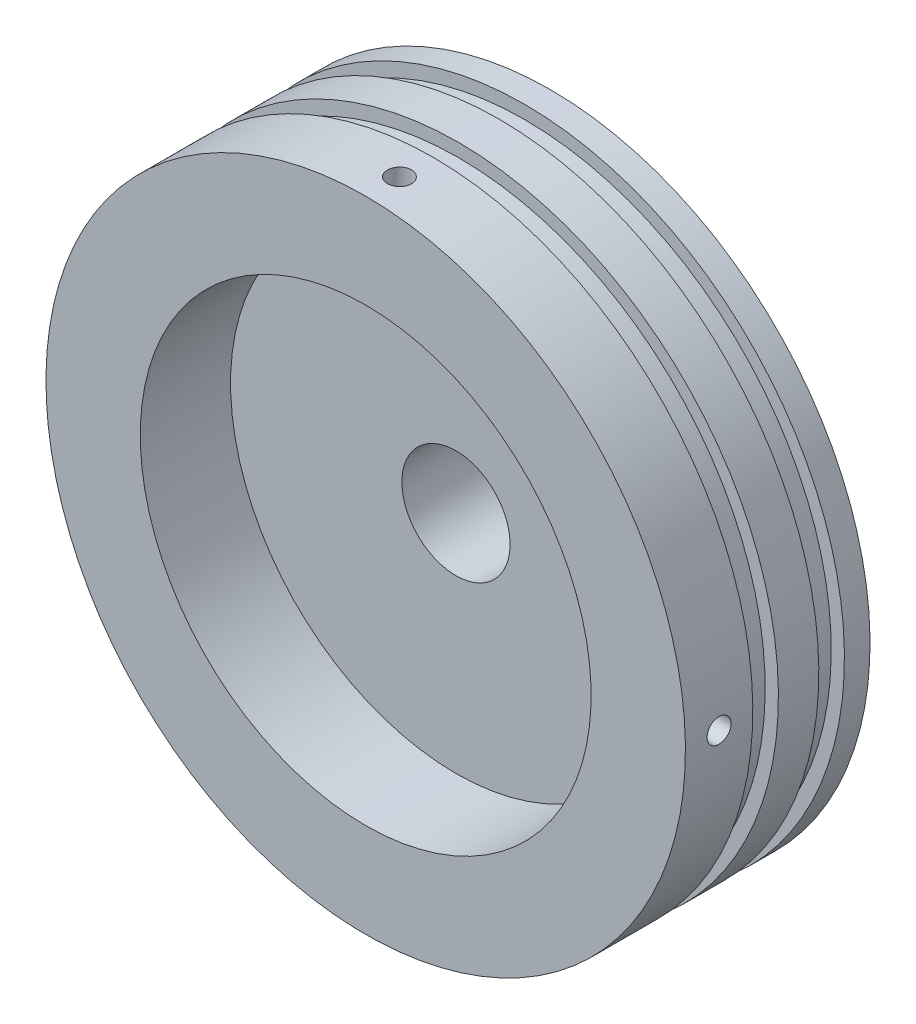
from build123d import *

# Parameters (mm, degrees)
F_4_40_TAPPED_HOLE1_D               = 2.2606
F_4_40_TAPPED_HOLE1_DEPTH           = 7.62
F_4_40_TAPPED_HOLE1_TIP             = 0.679152758
F_4_40_TAPPED_HOLE1_ON_FACE_2_D     = 2.2606
F_4_40_TAPPED_HOLE1_ON_FACE_2_DEPTH = 7.62
F_4_40_TAPPED_HOLE1_ON_FACE_2_TIP   = 0.679152758
F_4_40_TAPPED_HOLE1_ON_FACE_3_D     = 2.2606
F_4_40_TAPPED_HOLE1_ON_FACE_3_DEPTH = 7.62
F_4_40_TAPPED_HOLE1_ON_FACE_3_TIP   = 0.679152758
F_4_40_TAPPED_HOLE1_ON_FACE_4_D     = 2.2606
F_4_40_TAPPED_HOLE1_ON_FACE_4_DEPTH = 7.62
F_4_40_TAPPED_HOLE1_ON_FACE_4_TIP   = 0.679152758
F_10_2_10_2_DIAMETER_HOLE1_D        = 10.2


with BuildPart() as part:
    # Sketch2 → Revolve1 (revolve)
    with BuildSketch(Plane(origin=(0, 0, 0), x_dir=(0, 0, -1), z_dir=(1, 0, 0))):
        Polygon((-17.399, 30.1371), (-11.049, 30.1371), (-11.049, 28.8925), (-8.636, 28.8925), (-8.636, 30.1371), (-4.826, 30.1371), (-4.826, 28.8925), (-2.413, 28.8925), (-2.413, 30.1371), (0, 30.1371), (0, 0), (-8.89, 0), (-8.89, 21.2471), (-17.399, 21.2471), align=None)
    revolve(axis=Axis((0, 0, 0), (0, 0, 1)))

    # #4-40 Tapped Hole1
    with Locations(Plane(origin=(0, -30.1371, 14.224), x_dir=(-1, 0, 0), z_dir=(0, -1, 0))):
        with Locations((0, 0)):
            Hole(F_4_40_TAPPED_HOLE1_D / 2, depth=F_4_40_TAPPED_HOLE1_DEPTH)
            with Locations((0, 0, -(F_4_40_TAPPED_HOLE1_DEPTH + F_4_40_TAPPED_HOLE1_TIP / 2))):  # 118° drill point
                Cone(0, F_4_40_TAPPED_HOLE1_D / 2, F_4_40_TAPPED_HOLE1_TIP, mode=Mode.SUBTRACT)

    # #4-40 Tapped Hole1 on face 2
    with Locations(Plane(origin=(30.1371, 0, 14.224), x_dir=(0, 0, 1), z_dir=(1, 0, 0))):
        with Locations((0, 0)):
            Hole(F_4_40_TAPPED_HOLE1_ON_FACE_2_D / 2, depth=F_4_40_TAPPED_HOLE1_ON_FACE_2_DEPTH)
            with Locations((0, 0, -(F_4_40_TAPPED_HOLE1_ON_FACE_2_DEPTH + F_4_40_TAPPED_HOLE1_ON_FACE_2_TIP / 2))):  # 118° drill point
                Cone(0, F_4_40_TAPPED_HOLE1_ON_FACE_2_D / 2, F_4_40_TAPPED_HOLE1_ON_FACE_2_TIP, mode=Mode.SUBTRACT)

    # #4-40 Tapped Hole1 on face 3
    with Locations(Plane(origin=(-30.1371, 0, 14.224), x_dir=(0, 0, -1), z_dir=(-1, 0, 0))):
        with Locations((0, 0)):
            Hole(F_4_40_TAPPED_HOLE1_ON_FACE_3_D / 2, depth=F_4_40_TAPPED_HOLE1_ON_FACE_3_DEPTH)
            with Locations((0, 0, -(F_4_40_TAPPED_HOLE1_ON_FACE_3_DEPTH + F_4_40_TAPPED_HOLE1_ON_FACE_3_TIP / 2))):  # 118° drill point
                Cone(0, F_4_40_TAPPED_HOLE1_ON_FACE_3_D / 2, F_4_40_TAPPED_HOLE1_ON_FACE_3_TIP, mode=Mode.SUBTRACT)

    # #4-40 Tapped Hole1 on face 4
    with Locations(Plane(origin=(0, 30.1371, 14.224), x_dir=(0, 0, 1), z_dir=(0, 1, 0))):
        with Locations((0, 0)):
            Hole(F_4_40_TAPPED_HOLE1_ON_FACE_4_D / 2, depth=F_4_40_TAPPED_HOLE1_ON_FACE_4_DEPTH)
            with Locations((0, 0, -(F_4_40_TAPPED_HOLE1_ON_FACE_4_DEPTH + F_4_40_TAPPED_HOLE1_ON_FACE_4_TIP / 2))):  # 118° drill point
                Cone(0, F_4_40_TAPPED_HOLE1_ON_FACE_4_D / 2, F_4_40_TAPPED_HOLE1_ON_FACE_4_TIP, mode=Mode.SUBTRACT)

    # Ø10.2 (10.2) Diameter Hole1 (through all)
    with Locations(Plane.XY.offset(8.89)):
        with Locations((0, 0)):
            Hole(F_10_2_10_2_DIAMETER_HOLE1_D / 2)


solid = part.part
